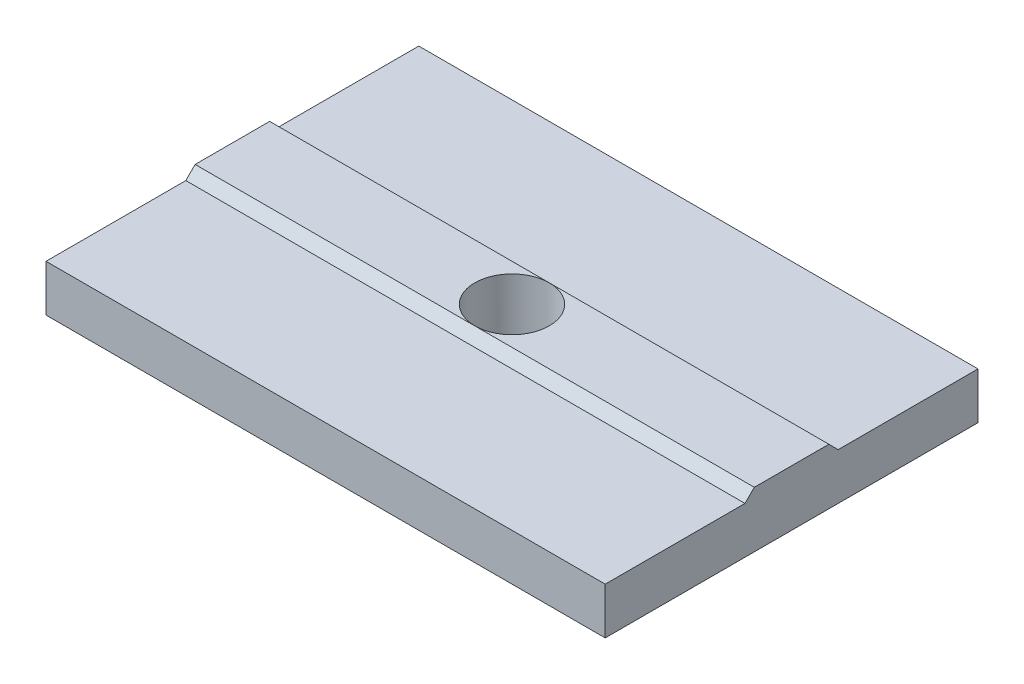
from build123d import *

# Parameters (mm, degrees)
SZKIC1_W                        = 60
SZKIC1_H                        = 40
DODANIE_WYCI_GNI_CIE1_DEPTH     = 5
SZKIC2_W                        = 60
SZKIC2_H                        = 10
DODANIE_WYCI_GNI_CIE2_DEPTH     = 6
SFAZOWANIE1_SIZE                = 1
WYTNIJ_WYCI_GNI_CIE1_DEPTH      = 37.551333765
WYTNIJ_WYCI_GNI_CIE1_DEPTH_BACK = 37.551333765
SZKIC3_R                        = 4


with BuildPart() as part:
    # Szkic1 → Dodanie-wyciągnięcie1 (new body)
    with BuildSketch(Plane(origin=(0, 0, 0), x_dir=(1, 0, 0), z_dir=(0, 1, 0))):
        Rectangle(SZKIC1_W, SZKIC1_H)
    extrude(amount=DODANIE_WYCI_GNI_CIE1_DEPTH)

    # Szkic2 → Dodanie-wyciągnięcie2 (add)
    with BuildSketch(Plane(origin=(0, 0, 0), x_dir=(1, 0, 0), z_dir=(0, 1, 0))):
        Rectangle(SZKIC2_W, SZKIC2_H)
    extrude(amount=DODANIE_WYCI_GNI_CIE2_DEPTH)

    # Sfazowanie1
    sfazowanie1_edges = [part.edges().sort_by_distance(p)[0] for p in [
        (0, 6, -5),
        (0, 6, 5),
    ]]
    chamfer(sfazowanie1_edges, length=SFAZOWANIE1_SIZE - 0.0001)  # a hair under: the kernel refuses the full size

    # Szkic3 → Wytnij-wyciągnięcie1 (cut, two sides: drawn at the far end of the back side and taken through both)
    with BuildSketch(Plane(origin=(0, 0, 0), x_dir=(1, 0, 0), z_dir=(0, 1, 0)).offset(-WYTNIJ_WYCI_GNI_CIE1_DEPTH_BACK)):
        with Locations(Location((0, 0, 0), (0, 0, 270))):
            Circle(SZKIC3_R)
    extrude(amount=WYTNIJ_WYCI_GNI_CIE1_DEPTH + WYTNIJ_WYCI_GNI_CIE1_DEPTH_BACK, mode=Mode.SUBTRACT)


solid = part.part
